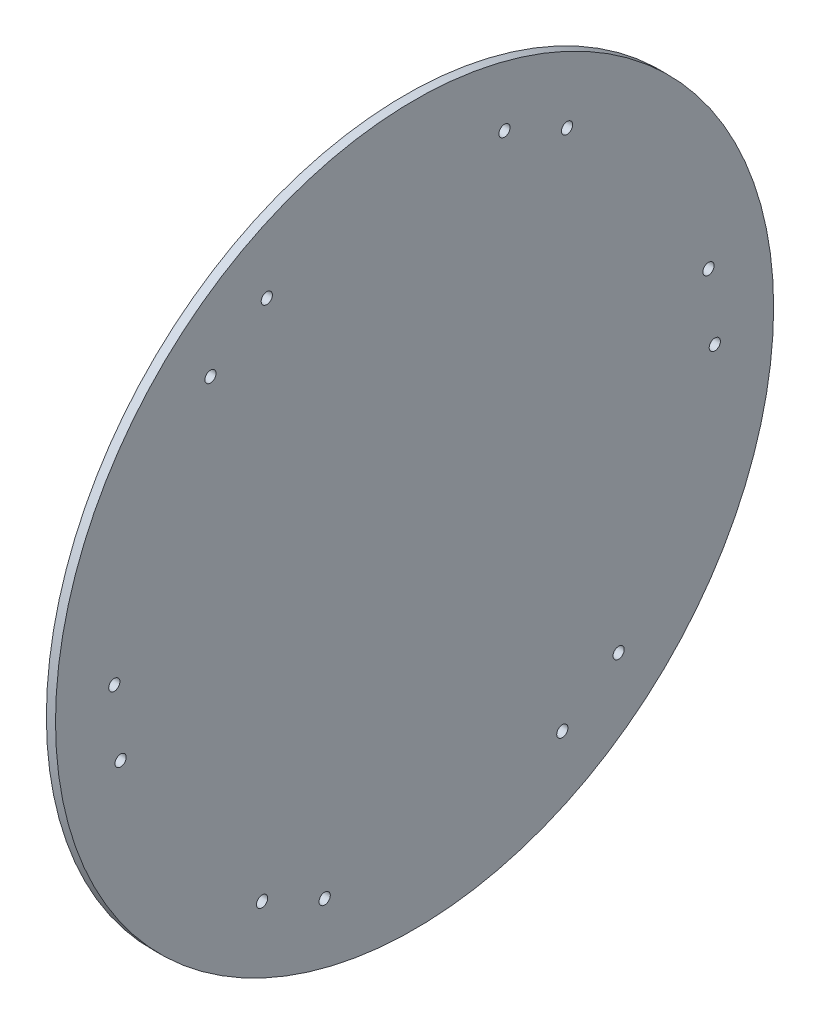
from build123d import *

# Parameters (mm, degrees)
SKETCH2_R           = 125
BOSS_EXTRUDE1_DEPTH = 3.18
SKETCH3_R           = 1.95
CUT_EXTRUDE1_DEPTH  = 177.80529517


with BuildPart() as part:
    # Sketch2 → Boss-Extrude1 (new body)
    with BuildSketch(Plane(origin=(0, 0, 0), x_dir=(0, 0, -1), z_dir=(1, 0, 0))):
        Circle(SKETCH2_R)
    extrude(amount=BOSS_EXTRUDE1_DEPTH)

    # Sketch3 → Cut-Extrude1 (cut, through all)
    with BuildSketch(Plane.ZY):
        with Locations((104.523481263, 0.949898407)):
            Circle(SKETCH3_R)
        with Locations((102.331811398, -22.949820906)):
            Circle(SKETCH3_R)
        with Locations((31.290777782, -100.096858738)):
            Circle(SKETCH3_R)
        with Locations((53.084376783, -90.045040862)):
            Circle(SKETCH3_R)
        with Locations((-51.43910448, -90.994939269)):
            Circle(SKETCH3_R)
        with Locations((-71.041033615, -77.147037833)):
            Circle(SKETCH3_R)
        with Locations((-102.331811398, 22.949820906)):
            Circle(SKETCH3_R)
        with Locations((-104.523481263, -0.949898407)):
            Circle(SKETCH3_R)
        with Locations((-53.084376783, 90.045040862)):
            Circle(SKETCH3_R)
        with Locations((-31.290777782, 100.096858738)):
            Circle(SKETCH3_R)
        with Locations((51.43910448, 90.994939269)):
            Circle(SKETCH3_R)
        with Locations((71.041033615, 77.147037833)):
            Circle(SKETCH3_R)
    extrude(amount=-CUT_EXTRUDE1_DEPTH, mode=Mode.SUBTRACT)


solid = part.part
